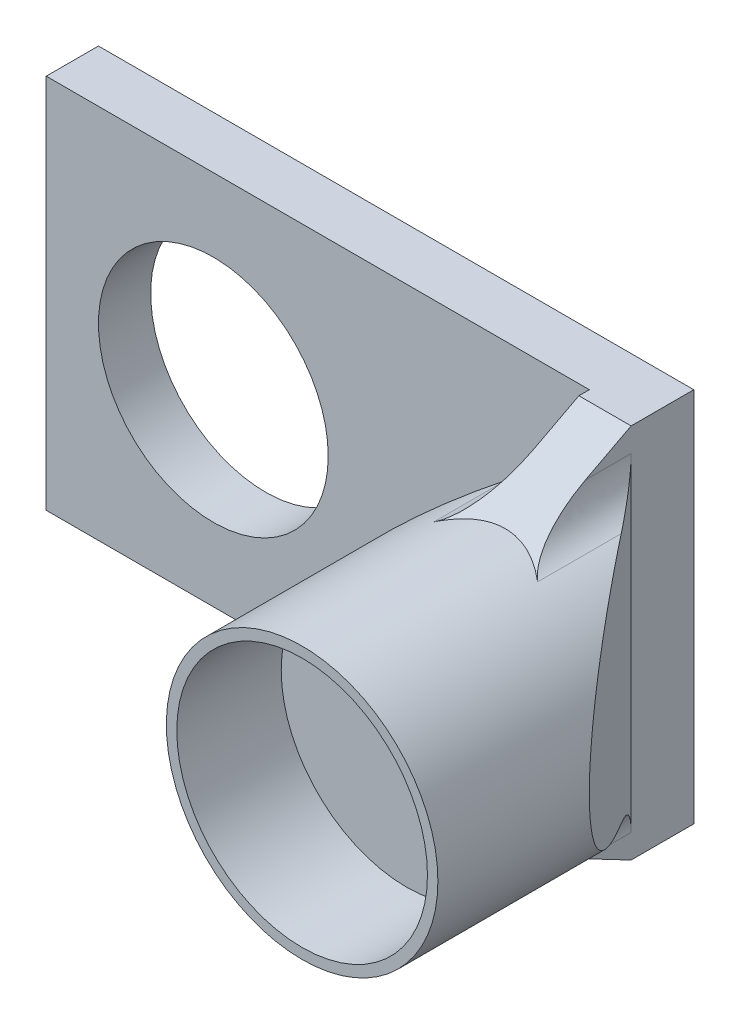
from build123d import *

# Parameters (mm, degrees)
SZKIC1_W                     = 18
SZKIC1_H                     = 18
DODANIE_WYCI_GNI_CIE1_DEPTH  = 2.5
SZKIC3_R                     = 6.5
SZKIC3_R_2                   = 6
DODANIE_WYCI_GNI_CIE2_DEPTH  = 5
SZKIC5_R                     = 6.5
DODANIE_WYCI_GNI_CIE3_DEPTH  = 9.5
SZKIC6_W                     = 2.5
SZKIC6_H                     = 18
DODANIE_WYCI_GNI_CIE4_DEPTH  = 3
WYTNIJ_WYCI_GNI_CIE3_DEPTH   = 20
DODANIE_WYCI_GNI_CIE11_DEPTH = 2.5
ZAOKR_GLENIE3_R              = 2
ZAOKR_GLENIE4_R              = 2
ZAOKR_GLENIE5_R              = 2
ZAOKR_GLENIE6_R              = 2
SZKIC21_W                    = 2.5
SZKIC21_H                    = 18
DODANIE_WYCI_GNI_CIE12_DEPTH = 8
SZKIC23_R                    = 5.5
WYTNIJ_WYCI_GNI_CIE4_DEPTH   = 2.5


with BuildPart() as part:
    # Szkic1 → Dodanie-wyciągnięcie1 (new body)
    with BuildSketch(Plane.XY):
        with Locations((9, -9)):
            Rectangle(SZKIC1_W, SZKIC1_H)
    extrude(amount=DODANIE_WYCI_GNI_CIE1_DEPTH)

    # Szkic6 → Dodanie-wyciągnięcie4 (add)
    with BuildSketch(Plane(origin=(0, 0, 0), x_dir=(-1, 0, 0), z_dir=(0, 0, -1))):
        with Locations((-19.25, -9)):
            Rectangle(SZKIC6_W, SZKIC6_H)
    extrude(amount=-DODANIE_WYCI_GNI_CIE4_DEPTH)



with BuildPart() as body_2:
    # Szkic3 → Dodanie-wyciągnięcie2 (new body)
    with BuildSketch(Plane.XY.offset(12.5)):
        with Locations((19.25, -9)):
            Circle(SZKIC3_R)
        with Locations((19.25, -9)):
            Circle(SZKIC3_R_2, mode=Mode.SUBTRACT)
    extrude(amount=DODANIE_WYCI_GNI_CIE2_DEPTH)

    # Szkic5 → Dodanie-wyciągnięcie3 (add)
    with BuildSketch(Plane.XY.offset(12.5)):
        with Locations((19.25, -9)):
            Circle(SZKIC5_R)
    extrude(amount=-DODANIE_WYCI_GNI_CIE3_DEPTH)

    # Szkic17 → Wytnij-wyciągnięcie3 (cut)
    with BuildSketch(Plane(origin=(0, 0, 0), x_dir=(1, 0, 0), z_dir=(0, 1, 0))):
        Polygon((20.5, -3), (25.75, -10.25), (25.75, -3), align=None)
        Polygon((18, -3), (12.696843968, -12.75), (12.75, -3), align=None)
    extrude(amount=-WYTNIJ_WYCI_GNI_CIE3_DEPTH, mode=Mode.SUBTRACT)


with BuildPart() as part_1:
    add(part.part)

    add(body_2.part)  # Dodanie-wyciągnięcie11 merges body 2
    # Szkic19 → Dodanie-wyciągnięcie11 (add)
    with BuildSketch(Plane(origin=(20.5, 0, 0), x_dir=(0, 0, -1), z_dir=(1, 0, 0))):
        Polygon((-3, -18), (-3, -15.378675411), (-8, -15.378675411), align=None)
        Polygon((-3, 0), (-3, -2.621324589), (-8, -2.621324589), align=None)
    extrude(amount=-DODANIE_WYCI_GNI_CIE11_DEPTH)

    # Zaokrąglenie3
    zaokr_glenie3_edges = [part_1.edges().sort_by_distance(p)[0] for p in [
        (20.5, -15.378675411, 5.5),
    ]]
    fillet(zaokr_glenie3_edges, radius=ZAOKR_GLENIE3_R)

    # Zaokrąglenie4
    zaokr_glenie4_edges = [part_1.edges().sort_by_distance(p)[0] for p in [
        (20.5, -2.621324589, 5.5),
    ]]
    fillet(zaokr_glenie4_edges, radius=ZAOKR_GLENIE4_R)

    # Zaokrąglenie5
    # the kernel refuses this fillet: 2 mm, written as the material it adds along each edge
    with BuildSketch(Plane(origin=(18, -15.378675411, -0.688659063), x_dir=(0, -1, 0), z_dir=(0, 0, 1))) as zaokr_glenie5_piece_1_section:
        with BuildLine():
            CenterArc((1.475463625, -2), ZAOKR_GLENIE5_R, 90, 67.520494391)
            ThreePointArc((-0.372569089, -1.235294118), (-0.155557822, -0.626914348), (0, 0))
            Line((0, 0), (1.475463625, 0))
        make_face()
    zaokr_glenie5_piece_1 = extrude(amount=12.377318126, mode=Mode.PRIVATE)
    zaokr_glenie5_piece_1 = split(zaokr_glenie5_piece_1, bisect_by=Plane(origin=(16.879667194, -15.616046578, 5.059763053), z_dir=(0.878464068971863, 0, 0.47780841299143956)), keep=Keep.TOP, mode=Mode.PRIVATE)
    zaokr_glenie5_piece_1 = split(zaokr_glenie5_piece_1, bisect_by=Plane(origin=(17.729689725, -16.448851128, 5.958711939), z_dir=(0, 0.8856656985010092, -0.46432345460758234)), keep=Keep.TOP, mode=Mode.PRIVATE)
    add(zaokr_glenie5_piece_1)

    # Zaokrąglenie6
    # the kernel refuses this fillet: 2 mm, written as the material it adds along each edge
    with BuildSketch(Plane(origin=(18, -2.621324589, -0.688659063), x_dir=(0, 1, 0), z_dir=(0, 0, 1))) as zaokr_glenie6_piece_1_section:
        with BuildLine():
            CenterArc((1.475463625, 2), ZAOKR_GLENIE6_R, 202.479505609, 67.520494391)
            ThreePointArc((-0.372569089, 1.235294118), (-0.155557822, 0.626914348), (0, 0))
            Line((0, 0), (1.475463625, 0))
        make_face()
    zaokr_glenie6_piece_1 = extrude(amount=12.377318126, mode=Mode.PRIVATE)
    zaokr_glenie6_piece_1 = split(zaokr_glenie6_piece_1, bisect_by=Plane(origin=(17.729689725, -1.551148872, 5.958711939), z_dir=(0, -0.8856656985010092, -0.4643234546075823)), keep=Keep.TOP, mode=Mode.PRIVATE)
    zaokr_glenie6_piece_1 = split(zaokr_glenie6_piece_1, bisect_by=Plane(origin=(16.879667194, -2.383953422, 5.059763053), z_dir=(0.8784640689720787, 0, 0.4778084129910428)), keep=Keep.TOP, mode=Mode.PRIVATE)
    add(zaokr_glenie6_piece_1)

    # Szkic21 → Dodanie-wyciągnięcie12 (add)
    with BuildSketch(Plane.ZY):
        with Locations((1.25, -9)):
            Rectangle(SZKIC21_W, SZKIC21_H)
    extrude(amount=DODANIE_WYCI_GNI_CIE12_DEPTH)

    # Szkic23 → Wytnij-wyciągnięcie4 (cut)
    with BuildSketch(Plane.XY.offset(2.5)):
        with Locations((0, -9)):
            Circle(SZKIC23_R)
    extrude(amount=-WYTNIJ_WYCI_GNI_CIE4_DEPTH, mode=Mode.SUBTRACT)


solid = part_1.part
